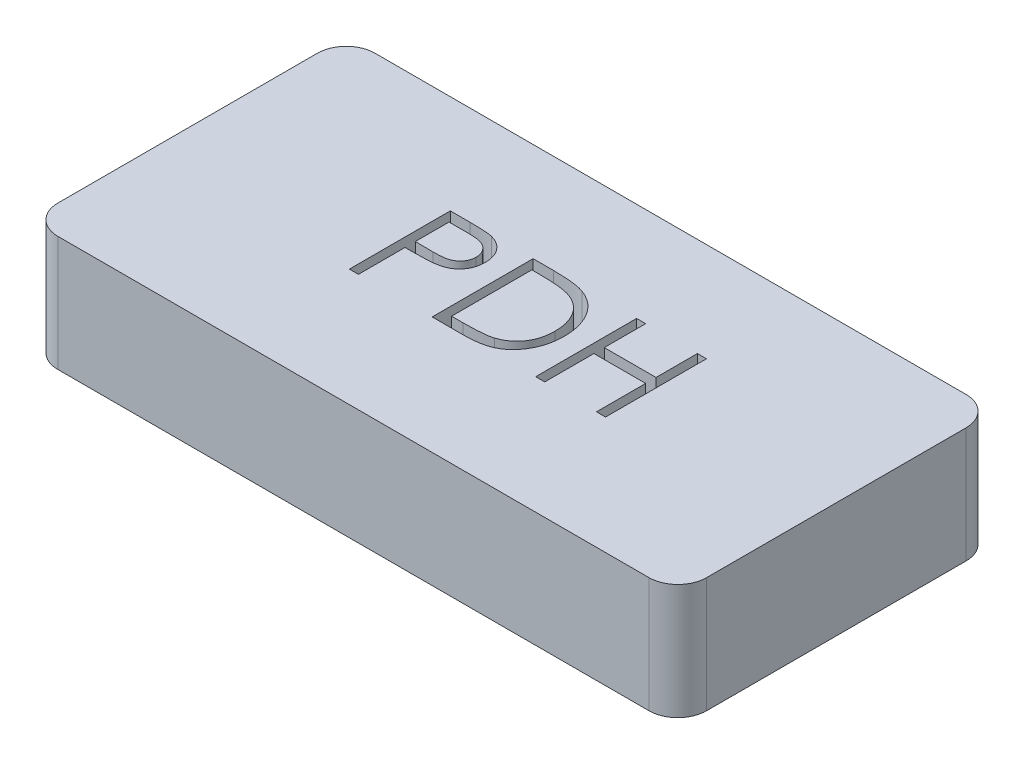
from build123d import *

# Parameters (mm, degrees)
SKETCH1_W           = 225
SKETCH1_H           = 110
BOSS_EXTRUDE1_DEPTH = 40
FILLET1_R           = 10
CUT_EXTRUDE1_DEPTH  = 40


with BuildPart() as part:
    # Sketch1 → Boss-Extrude1 (new body)
    with BuildSketch(Plane(origin=(0, 0, 0), x_dir=(1, 0, 0), z_dir=(0, 1, 0))):
        Rectangle(SKETCH1_W, SKETCH1_H)
    extrude(amount=BOSS_EXTRUDE1_DEPTH)

    # Fillet1
    fillet1_edges = [part.edges().sort_by_distance(p)[0] for p in [
        (112.5, 20, -55),
        (112.5, 20, 55),
        (-112.5, 20, 55),
        (-112.5, 20, -55),
    ]]
    fillet(fillet1_edges, radius=FILLET1_R)

    # Sketch2 → Cut-Extrude1 (cut)
    # profile 1 of 3: a face of its own
    with BuildSketch(Plane(origin=(0, 40, 0), x_dir=(1, 0, 0), z_dir=(0, 1, 0))):
        with BuildLine():
            Line((-42.100458079, 20.700824113), (-35.236475708, 20.700824113))
            add(Edge.make_bspline(
                [(-35.236475708, 20.700824113), (-34.764366646, 20.700305151), (-33.859784718, 20.699310796), (-32.562634161, 20.669163338), (-31.384536845, 20.628896417), (-30.328033035, 20.573077485), (-29.389872054, 20.507111582), (-28.574299059, 20.414591188), (-27.874903496, 20.317988233), (-27.455839001, 20.219774168), (-27.2647209, 20.174982767)],
                knots=[0, 0, 0, 0, 1.415646017, 2.712440637, 3.8905458, 4.950247383, 5.884950622, 6.709939814, 7.411656543, 8, 8, 8, 8], degree=3))
            add(Edge.make_bspline(
                [(-27.2647209, 20.174982767), (-27.022785562, 20.108763269), (-26.54461579, 19.977884652), (-25.855605359, 19.715747417), (-25.200066904, 19.404925765), (-24.57575132, 19.050686367), (-23.990330489, 18.637830725), (-23.435070079, 18.183094547), (-22.914870276, 17.675978862), (-22.432656357, 17.122171463), (-21.989808382, 16.530969364), (-21.608511554, 15.893547065), (-21.289239284, 15.220634031), (-21.015406569, 14.51269832), (-20.818322024, 13.763795085), (-20.669853027, 12.979127961), (-20.575616751, 12.158781059), (-20.566591134, 11.598182384), (-20.561996541, 11.31280328)],
                knots=[0, 0, 0, 0, 0.999701418, 1.975846123, 2.934577507, 3.890451536, 4.834027766, 5.787354733, 6.749476667, 7.726910423, 8.712836071, 9.690891519, 10.682875813, 11.679750201, 12.712814741, 13.765529915, 14.8625177, 16, 16, 16, 16], degree=3))
            add(Edge.make_bspline(
                [(-20.561996541, 11.31280328), (-20.566210788, 11.025025512), (-20.574456248, 10.461968873), (-20.673419101, 9.638240991), (-20.806721017, 8.851057089), (-21.01169154, 8.102162585), (-21.280148271, 7.39600488), (-21.5950688, 6.72179256), (-21.974904104, 6.090995841), (-22.411352401, 5.501324665), (-22.896868345, 4.952225542), (-23.429397726, 4.447677597), (-24.006790651, 3.990634213), (-24.627212132, 3.580070776), (-25.29671062, 3.225507981), (-26.005132156, 2.907934932), (-26.75863432, 2.641224326), (-27.28005946, 2.500923711), (-27.545169618, 2.429590139)],
                knots=[0, 0, 0, 0, 1.121902311, 2.195077645, 3.232258892, 4.234102512, 5.217864754, 6.176164875, 7.132989551, 8.084763148, 9.034132444, 9.988522005, 10.94243251, 11.903244335, 12.886203696, 13.894208494, 14.929344452, 16, 16, 16, 16], degree=3))
            add(Edge.make_bspline(
                [(-27.545169618, 2.429590139), (-27.764442958, 2.382960328), (-28.244993231, 2.280768387), (-29.036420453, 2.166683818), (-29.957874312, 2.069307811), (-31.008097112, 1.996296435), (-32.186146161, 1.933792751), (-33.492658734, 1.884111812), (-34.930199506, 1.856813274), (-35.932911947, 1.855405346), (-36.456427631, 1.854670267)],
                knots=[0, 0, 0, 0, 0.601384939, 1.31797006, 2.144135048, 3.087295005, 4.142315834, 5.309527816, 6.595305764, 8, 8, 8, 8], degree=3))
            Line((-36.456427631, 1.854670267), (-38.959432438, 1.854670267))
            Line((-38.959432438, 1.854670267), (-38.959432438, -14.299175887))
            Line((-38.959432438, -14.299175887), (-42.100458079, -14.299175887))
            Line((-42.100458079, -14.299175887), (-42.100458079, 20.700824113))
        make_face()
        with BuildLine():
            Line((-38.959432438, 17.111080523), (-38.959432438, 5.444413857))
            Line((-38.959432438, 5.444413857), (-32.831627951, 5.367290459))
            add(Edge.make_bspline(
                [(-32.831627951, 5.367290459), (-32.532428693, 5.367135823), (-31.954830694, 5.366837302), (-31.120468461, 5.406689537), (-30.346375588, 5.452694863), (-29.634929835, 5.520054098), (-28.98581049, 5.615266673), (-28.397935201, 5.711384052), (-27.875862372, 5.850437678), (-27.264870354, 6.03766837), (-26.58403688, 6.356994526), (-25.843361394, 6.820493427), (-25.215655531, 7.411300509), (-24.672472563, 8.075578822), (-24.241413784, 8.814570116), (-23.925853861, 9.605259483), (-23.740442287, 10.439537979), (-23.715580351, 11.010419367), (-23.703022182, 11.298780844)],
                knots=[0, 0, 0, 0, 1.160613943, 2.240541288, 3.23993089, 4.169200891, 5.011653406, 5.7853311, 6.478053781, 7.106038997, 8.262395093, 9.384106736, 10.481365981, 11.59014053, 12.70357646, 13.786202915, 14.881775077, 16, 16, 16, 16], degree=3))
            add(Edge.make_bspline(
                [(-23.703022182, 11.298780844), (-23.715648647, 11.580165978), (-23.740748496, 12.1395248), (-23.927307128, 12.959312406), (-24.240800267, 13.74166945), (-24.675366212, 14.471400304), (-25.202777511, 15.133288343), (-25.815770943, 15.708259614), (-26.512903556, 16.170476641), (-27.161385866, 16.468809458), (-27.737397727, 16.650962212), (-28.237717325, 16.778410617), (-28.80262407, 16.880166679), (-29.432301865, 16.962561707), (-30.121870204, 17.033096319), (-30.877253353, 17.080956092), (-31.695589786, 17.108970654), (-32.263695494, 17.110360206), (-32.558190451, 17.111080523)],
                knots=[0, 0, 0, 0, 1.120700087, 2.227813068, 3.331159281, 4.466773991, 5.599788987, 6.693661531, 7.80175334, 8.91857717, 9.525282508, 10.207424825, 10.974604443, 11.810962634, 12.737642355, 13.736264703, 14.826523623, 16, 16, 16, 16], degree=3))
            Line((-32.558190451, 17.111080523), (-38.959432438, 17.111080523))
        make_face(mode=Mode.SUBTRACT)
    # profile 2 of 3: a face of its own
    with BuildSketch(Plane(origin=(0, 40, 0), x_dir=(1, 0, 0), z_dir=(0, 1, 0))):
        with BuildLine():
            Line((-13.382509361, -14.299175887), (-13.382509361, 20.700824113))
            Line((-13.382509361, 20.700824113), (-6.315201669, 20.700824113))
            add(Edge.make_bspline(
                [(-6.315201669, 20.700824113), (-5.700511787, 20.696398413), (-4.512934134, 20.687847984), (-2.796809659, 20.633634073), (-1.208972035, 20.537729414), (0.245356556, 20.398034153), (1.570168676, 20.226503817), (2.761754757, 20.011499773), (3.826276186, 19.757618069), (4.480970592, 19.541163567), (4.790567562, 19.438804882)],
                knots=[0, 0, 0, 0, 1.314313732, 2.53924729, 3.670748893, 4.714932338, 5.66265055, 6.526160246, 7.303039223, 8, 8, 8, 8], degree=3))
            add(Edge.make_bspline(
                [(4.790567562, 19.438804882), (5.195514955, 19.284497826), (5.996226878, 18.979382885), (7.136298103, 18.403819872), (8.209551733, 17.751688854), (9.221743182, 17.022130227), (10.149751446, 16.194486743), (11.029830413, 15.303915886), (11.825977651, 14.318032484), (12.555060611, 13.257282604), (13.212417206, 12.134162082), (13.783808784, 10.950810995), (14.258348718, 9.713238915), (14.652280984, 8.424887435), (14.962745559, 7.082923657), (15.174564876, 5.685784996), (15.314274775, 4.238993102), (15.328315288, 3.257248465), (15.335439357, 2.759117382)],
                knots=[0, 0, 0, 0, 0.984719456, 1.947108742, 2.898477687, 3.838006223, 4.779231079, 5.722358779, 6.681677486, 7.655904652, 8.64651281, 9.637519902, 10.640069247, 11.656948941, 12.698408672, 13.768548281, 14.867775369, 16, 16, 16, 16], degree=3))
            add(Edge.make_bspline(
                [(15.335439357, 2.759117382), (15.329149682, 2.326504998), (15.316755221, 1.473997108), (15.205462062, 0.217588152), (15.043698861, -1.001547561), (14.793256883, -2.177604562), (14.489231749, -3.320886741), (14.099590236, -4.419209184), (13.653235274, -5.482647277), (13.132736488, -6.496822037), (12.561322638, -7.45765576), (11.948105206, -8.363411041), (11.293738252, -9.201163259), (10.591981923, -9.97344938), (9.851904759, -10.679105164), (9.068661453, -11.324025317), (8.240230945, -11.895590865), (7.370323718, -12.416261948), (6.433562426, -12.870465503), (5.412203764, -13.254765601), (4.301891984, -13.573231755), (3.105352415, -13.838940713), (1.820517638, -14.049713739), (0.446127979, -14.190977663), (-1.015704918, -14.28650699), (-2.01949757, -14.294870924), (-2.536155195, -14.299175887)],
                knots=[0, 0, 0, 0, 1.105936401, 2.179363191, 3.223086493, 4.248585256, 5.251745608, 6.245858792, 7.225916811, 8.198733463, 9.158002045, 10.082870192, 10.993790845, 11.873723703, 12.748670949, 13.606408763, 14.465103618, 15.319838547, 16.196477973, 17.123216899, 18.106603292, 19.147568657, 20.255746949, 21.433717677, 22.679120308, 24, 24, 24, 24], degree=3))
            Line((-2.536155195, -14.299175887), (-13.382509361, -14.299175887))
        make_face()
        with BuildLine():
            Line((-10.24148372, -10.709432297), (-6.224055836, -10.709432297))
            add(Edge.make_bspline(
                [(-6.224055836, -10.709432297), (-5.646772128, -10.706951333), (-4.536444144, -10.702179531), (-2.939864171, -10.6603075), (-1.481070207, -10.591888125), (-0.159855113, -10.496137347), (1.02303513, -10.369451195), (2.070072629, -10.228202168), (2.977825212, -10.05222766), (3.527119582, -9.892718066), (3.780952177, -9.819007618)],
                knots=[0, 0, 0, 0, 1.375205317, 2.645023457, 3.804390687, 4.853969522, 5.800190428, 6.637939096, 7.370582563, 8, 8, 8, 8], degree=3))
            add(Edge.make_bspline(
                [(3.780952177, -9.819007618), (4.100435798, -9.706492035), (4.73177218, -9.484148303), (5.640583032, -9.078571691), (6.488153078, -8.598150993), (7.289253331, -8.064128253), (8.032519885, -7.457668233), (8.726761049, -6.791958345), (9.370579062, -6.063610594), (9.957322142, -5.273528979), (10.482405182, -4.426631022), (10.937117476, -3.531242686), (11.335632792, -2.597174584), (11.648418719, -1.610082997), (11.89357456, -0.578792413), (12.06722144, 0.49676972), (12.175368684, 1.616402538), (12.187983164, 2.377923781), (12.194413716, 2.7661286)],
                knots=[0, 0, 0, 0, 0.998632004, 1.973411704, 2.929992603, 3.868527914, 4.809262121, 5.754881198, 6.702106254, 7.672490631, 8.653608572, 9.636854334, 10.631411391, 11.644891563, 12.686317036, 13.754757253, 14.855430412, 16, 16, 16, 16], degree=3))
            add(Edge.make_bspline(
                [(12.194413716, 2.7661286), (12.189280842, 3.175463403), (12.179197266, 3.979605247), (12.052454162, 5.1595122), (11.867238607, 6.294318705), (11.599401747, 7.384100659), (11.258092958, 8.430984181), (10.832146541, 9.429179283), (10.345480348, 10.389227971), (9.766446979, 11.288971629), (9.132291046, 12.13990272), (8.428512252, 12.919451876), (7.666291867, 13.629394879), (6.853943373, 14.280788005), (5.96857238, 14.847424764), (5.031035472, 15.354291575), (4.02757876, 15.784450488), (3.329451802, 16.013239116), (2.974662113, 16.129510011)],
                knots=[0, 0, 0, 0, 1.122418816, 2.205001699, 3.251619955, 4.274784885, 5.280384055, 6.268708349, 7.249350384, 8.229342522, 9.199999885, 10.157847722, 11.105861043, 12.055065948, 13.010012805, 13.98527497, 14.976112212, 16, 16, 16, 16], degree=3))
            add(Edge.make_bspline(
                [(2.974662113, 16.129510011), (2.681150649, 16.210674289), (2.057064746, 16.383251815), (1.038670106, 16.57150554), (-0.107481388, 16.73755053), (-1.386478399, 16.878130924), (-2.79686299, 16.979004137), (-4.33971987, 17.054717283), (-6.015715916, 17.105783608), (-7.177541254, 17.10927068), (-7.78054622, 17.111080523)],
                knots=[0, 0, 0, 0, 0.674548936, 1.434276114, 2.292660221, 3.240891867, 4.284742987, 5.42552168, 6.663806718, 8, 8, 8, 8], degree=3))
            Line((-7.78054622, 17.111080523), (-10.24148372, 17.111080523))
            Line((-10.24148372, 17.111080523), (-10.24148372, -10.709432297))
        make_face(mode=Mode.SUBTRACT)
    # profile 3 of 3: a face of its own
    with BuildSketch(Plane(origin=(0, 40, 0), x_dir=(1, 0, 0), z_dir=(0, 1, 0))):
        Polygon((22.514926536, 20.700824113), (25.655952177, 20.700824113), (25.655952177, 6.341849754), (43.604670126, 6.341849754), (43.604670126, 20.700824113), (46.745695767, 20.700824113), (46.745695767, -14.299175887), (43.604670126, -14.299175887), (43.604670126, 2.752106165), (25.655952177, 2.752106165), (25.655952177, -14.299175887), (22.514926536, -14.299175887), align=None)
    extrude(amount=-CUT_EXTRUDE1_DEPTH, mode=Mode.SUBTRACT)


with BuildPart() as cut_extrude1_piece_1:
    # of the separate pieces the step leaves, piece 1, a body of its own (cut_extrude1_pieces)
    add(part.part.solids().sort_by_distance((102.5, 0, 55))[0])


with BuildPart() as cut_extrude1_piece_2:
    # of the separate pieces the step leaves, piece 2, a body of its own (cut_extrude1_pieces)
    add(part.part.solids().sort_by_distance((-10.24148372, 0, 10.709432297))[0])


with BuildPart() as cut_extrude1_piece_3:
    # of the separate pieces the step leaves, piece 3, a body of its own (cut_extrude1_pieces)
    add(part.part.solids().sort_by_distance((-38.959432438, 0, -17.111080523))[0])


solid = Compound([cut_extrude1_piece_1.part, cut_extrude1_piece_2.part, cut_extrude1_piece_3.part])
